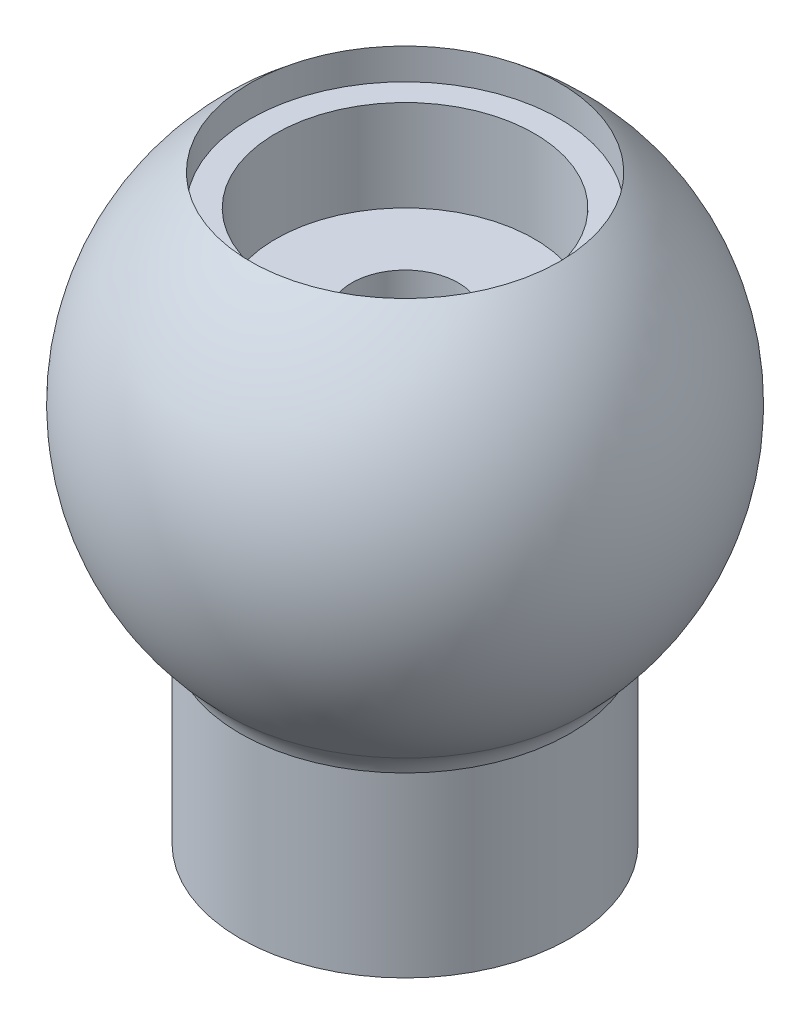
from build123d import *

# Parameters (mm, degrees)
SKETCH1_R           = 3.2500000000000004
BOSS_EXTRUDE1_DEPTH = 3.5
SKETCH5_W           = 3.0499999999999994
SKETCH5_H           = 2.603568585765487
SKETCH7_R           = 2.5500000000000003
CUT_EXTRUDE1_DEPTH  = 1.8
SKETCH8_R           = 1.05
CUT_EXTRUDE2_DEPTH  = 12.484881366397794
FILLET1_R           = 1


with BuildPart() as part:
    # Sketch1 → Boss-Extrude1 (new body)
    with BuildSketch(Plane(origin=(0, 0, 0), x_dir=(1, 0, 0), z_dir=(0, 1, 0))):
        with Locations(Location((0, 0, 0), (0, 0, 270))):
            Circle(SKETCH1_R)
    extrude(amount=BOSS_EXTRUDE1_DEPTH)

    # Sweep2: read off the stored shape, not the designer's step
    # Sweep2 outline → Sweep2 (revolve)
    with BuildSketch(Plane.XY):
        with BuildLine():
            Line((0, 12.5), (0, 3.499999997))
            Line((0, 3.499999997), (2.999999996, 3.499999997))
            ThreePointArc((2.999999996, 3.499999997), (4.743416491, 9.081138828), (0, 12.5))
        make_face()
    revolve(axis=Axis((0, 0, 0), (0, 1, 0)))

    # Cut-Sweep2: sweep along a curve in space
    with BuildLine() as cut_sweep2_path:
        ThreePointArc((0, 3.4999999999999996, 3.000000000000002), (2.121320343559644, 3.4999999999999996, 2.121320343559644), (3.000000000000002, 3.4999999999999996, 0))
        ThreePointArc((3.000000000000002, 3.4999999999999996, 0), (2.121320343559644, 3.4999999999999996, -2.121320343559644), (0, 3.4999999999999996, -3.000000000000002))
        ThreePointArc((0, 3.4999999999999996, -3.000000000000002), (-2.121320343559644, 3.4999999999999996, -2.121320343559644), (-3.000000000000002, 3.4999999999999996, 0))
        ThreePointArc((-3.000000000000002, 3.4999999999999996, 0), (-2.121320343559644, 3.4999999999999996, 2.121320343559644), (0, 3.4999999999999996, 3.000000000000002))
    # Sketch5 → Cut-Sweep2 (sweep, cut)
    with BuildSketch(Plane.XY):
        with Locations((1.5249999999999997, 12.151784292882743)):
            Rectangle(SKETCH5_W, SKETCH5_H)
    sweep(path=cut_sweep2_path.line, mode=Mode.SUBTRACT)

    # Sketch7 → Cut-Extrude1 (cut)
    with BuildSketch(Plane(origin=(0, 10.85, 0), x_dir=(1, 0, 0), z_dir=(0, 1, 0))):
        with Locations(Location((0, 0, 0), (0, 0, 270))):
            Circle(SKETCH7_R)
    extrude(amount=-CUT_EXTRUDE1_DEPTH, mode=Mode.SUBTRACT)

    # Sketch8 → Cut-Extrude2 (cut, through all)
    with BuildSketch(Plane(origin=(0, 9.05, 0), x_dir=(1, 0, 0), z_dir=(0, 1, 0))):
        with Locations(Location((0, 0, 0), (0, 0, 270))):
            Circle(SKETCH8_R)
    extrude(amount=-CUT_EXTRUDE2_DEPTH, mode=Mode.SUBTRACT)

    # Fillet1
    # the kernel refuses this fillet: 1 mm, written as the material it adds along each edge
    with BuildSketch(Plane(origin=(0, 3.4999999970000006, 0), x_dir=(1, 0, 0), z_dir=(0, 0, 1))) as fillet1_piece_1:
        with BuildLine():
            CenterArc((4.21199518408407, -0.27306640979926655), FILLET1_R, 134.58762076250994, 29.565561163496568)
            ThreePointArc((3.5099959867224584, 0.4391113256738759), (3.2623943067411867, 0.21096537839129237), (2.9999999959999997, 0))
            Line((2.9999999959999997, 0), (3.250000000000001, 2.99999936e-09))
        make_face()
    revolve(axis=Axis((0, 3.4999999970000006, 0), (0, 1, 0)))


solid = part.part
